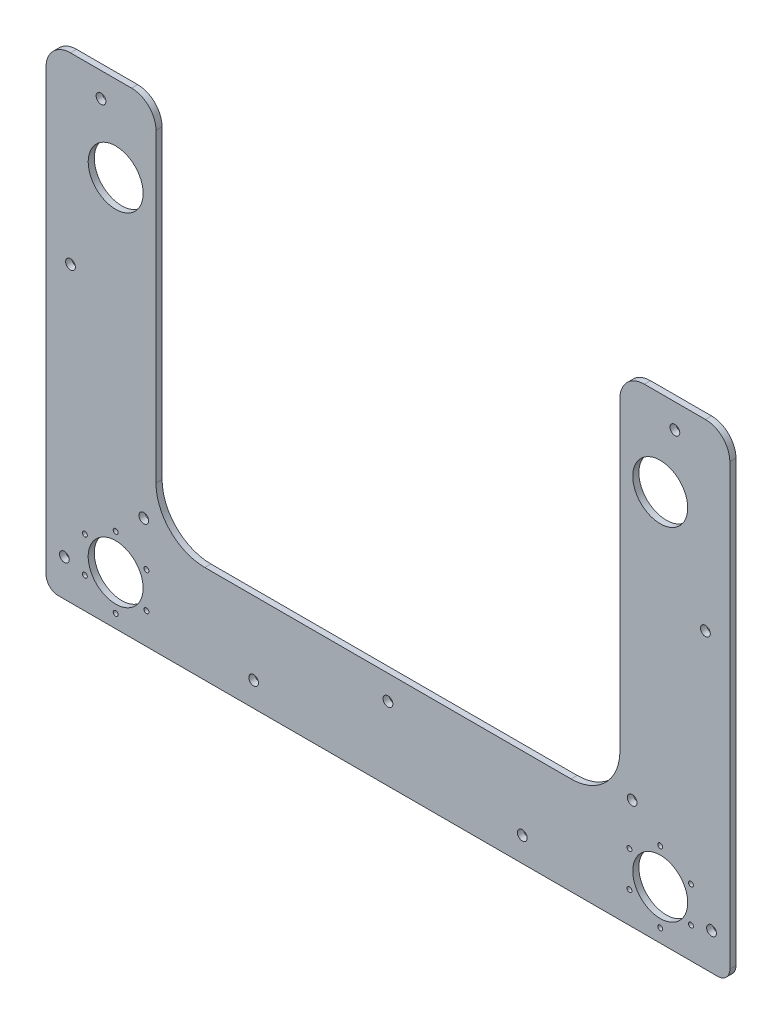
from build123d import *

# Parameters (mm, degrees)
SKETCH1_R           = 14.2875
SKETCH1_R_2         = 1.27
SKETCH1_R_3         = 2.54
BOSS_EXTRUDE3_DEPTH = 3.175


with BuildPart() as part:
    # Sketch1 → Boss-Extrude3 (new body)
    with BuildSketch(Plane.XY):
        with BuildLine():
            Line((120.65, -152.4), (120.65, -6.35))
            Line((120.65, -6.35), (120.65, 6.35))
            ThreePointArc((120.65, 6.35), (124.369743879, 15.330256121), (133.35, 19.05))
            Line((133.35, 19.05), (165.1, 19.05))
            ThreePointArc((165.1, 19.05), (174.080256121, 15.330256121), (177.8, 6.35))
            Line((177.8, 6.35), (177.8, -6.35))
            Line((177.8, -6.35), (177.8, -222.25))
            ThreePointArc((177.8, -222.25), (175.940128061, -226.740128061), (171.45, -228.6))
            Line((171.45, -228.6), (12.7, -228.6))
            Line((12.7, -228.6), (-12.7, -228.6))
            Line((-12.7, -228.6), (-171.45, -228.6))
            ThreePointArc((-171.45, -228.6), (-175.940128061, -226.740128061), (-177.8, -222.25))
            Line((-177.8, -222.25), (-177.8, -6.35))
            Line((-177.8, -6.35), (-177.8, 6.35))
            ThreePointArc((-177.8, 6.35), (-174.080256121, 15.330256121), (-165.1, 19.05))
            Line((-165.1, 19.05), (-133.35, 19.05))
            ThreePointArc((-133.35, 19.05), (-124.369743879, 15.330256121), (-120.65, 6.35))
            Line((-120.65, 6.35), (-120.65, -6.35))
            Line((-120.65, -6.35), (-120.65, -152.4))
            ThreePointArc((-120.65, -152.4), (-113.210512242, -170.360512242), (-95.25, -177.8))
            Line((-95.25, -177.8), (-12.7, -177.8))
            Line((-12.7, -177.8), (12.7, -177.8))
            Line((12.7, -177.8), (95.25, -177.8))
            ThreePointArc((95.25, -177.8), (113.210512242, -170.360512242), (120.65, -152.4))
        make_face()
        with Locations((141.605, -25.4)):
            Circle(SKETCH1_R, mode=Mode.SUBTRACT)
        with Locations((-141.605, -25.4)):
            Circle(SKETCH1_R, mode=Mode.SUBTRACT)
        with Locations((-141.605, -203.2)):
            Circle(SKETCH1_R, mode=Mode.SUBTRACT)
        with Locations((-141.605, -184.722481985)):
            Circle(SKETCH1_R_2, mode=Mode.SUBTRACT)
        with Locations((-125.603, -193.961240992)):
            Circle(SKETCH1_R_2, mode=Mode.SUBTRACT)
        with Locations((-125.603, -212.438759008)):
            Circle(SKETCH1_R_2, mode=Mode.SUBTRACT)
        with Locations((-141.605, -221.677518015)):
            Circle(SKETCH1_R_2, mode=Mode.SUBTRACT)
        with Locations((-157.607, -212.438759008)):
            Circle(SKETCH1_R_2, mode=Mode.SUBTRACT)
        with Locations((-157.607, -193.961240992)):
            Circle(SKETCH1_R_2, mode=Mode.SUBTRACT)
        with Locations((157.607, -212.438759008)):
            Circle(SKETCH1_R_2, mode=Mode.SUBTRACT)
        with Locations((157.607, -193.961240992)):
            Circle(SKETCH1_R_2, mode=Mode.SUBTRACT)
        with Locations((141.605, -184.722481985)):
            Circle(SKETCH1_R_2, mode=Mode.SUBTRACT)
        with Locations((125.603, -193.961240992)):
            Circle(SKETCH1_R_2, mode=Mode.SUBTRACT)
        with Locations((125.603, -212.438759008)):
            Circle(SKETCH1_R_2, mode=Mode.SUBTRACT)
        with Locations((141.605, -221.677518015)):
            Circle(SKETCH1_R_2, mode=Mode.SUBTRACT)
        with Locations((141.605, -203.2)):
            Circle(SKETCH1_R, mode=Mode.SUBTRACT)
        with Locations((-69.85, -215.9)):
            Circle(SKETCH1_R_3, mode=Mode.SUBTRACT)
        with Locations((69.85, -215.9)):
            Circle(SKETCH1_R_3, mode=Mode.SUBTRACT)
        with Locations((0, -190.5)):
            Circle(SKETCH1_R_3, mode=Mode.SUBTRACT)
        with Locations((-127, -171.45)):
            Circle(SKETCH1_R_3, mode=Mode.SUBTRACT)
        with Locations((-149.225, 6.35)):
            Circle(SKETCH1_R_3, mode=Mode.SUBTRACT)
        with Locations((127, -171.45)):
            Circle(SKETCH1_R_3, mode=Mode.SUBTRACT)
        with Locations((149.225, 6.35)):
            Circle(SKETCH1_R_3, mode=Mode.SUBTRACT)
        with Locations((-168.275, -209.55)):
            Circle(SKETCH1_R_3, mode=Mode.SUBTRACT)
        with Locations((168.275, -209.55)):
            Circle(SKETCH1_R_3, mode=Mode.SUBTRACT)
        with Locations((-165.1, -76.2)):
            Circle(SKETCH1_R_3, mode=Mode.SUBTRACT)
        with Locations((165.1, -76.2)):
            Circle(SKETCH1_R_3, mode=Mode.SUBTRACT)
    extrude(amount=BOSS_EXTRUDE3_DEPTH)


solid = part.part
